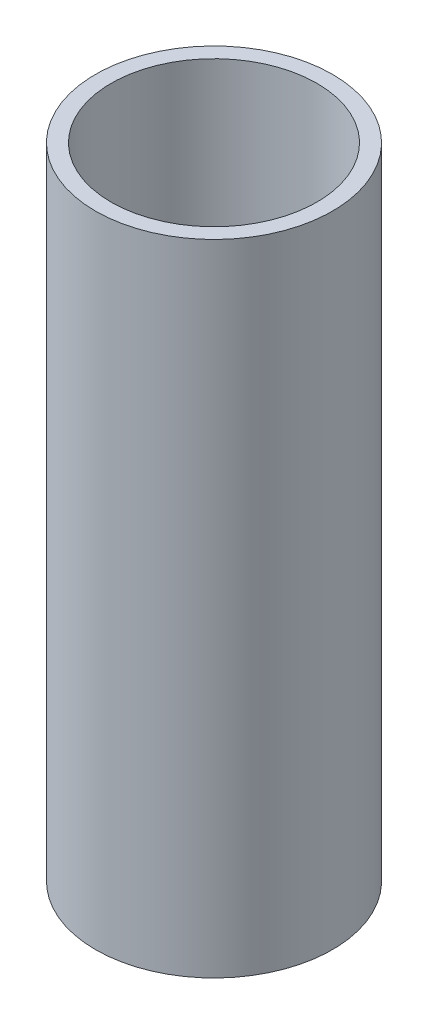
from build123d import *

# Parameters (mm, degrees)
SKETCH1_R           = 21.082
BOSS_EXTRUDE1_DEPTH = 113.792
SKETCH5_R           = 18.3134
CUT_EXTRUDE2_DEPTH  = 111.0234
SKETCH7_R           = 6.35
BOSS_EXTRUDE2_DEPTH = 10.16
THREAD1_PITCH       = 1.27
SKETCH19_R          = 4.445
CUT_EXTRUDE3_DEPTH  = 128.487253325


with BuildPart() as part:
    # Sketch1 → Boss-Extrude1 (new body)
    with BuildSketch(Plane(origin=(0, 0, 0), x_dir=(1, 0, 0), z_dir=(0, 1, 0))):
        with Locations(Location((0, 0, 0), (0, 0, 270))):
            Circle(SKETCH1_R)
    extrude(amount=BOSS_EXTRUDE1_DEPTH)

    # Sketch5 → Cut-Extrude2 (cut)
    with BuildSketch(Plane(origin=(0, 113.792, 0), x_dir=(1, 0, 0), z_dir=(0, 1, 0))):
        with Locations(Location((0, 0, 0), (0, 0, 270))):
            Circle(SKETCH5_R)
    extrude(amount=-CUT_EXTRUDE2_DEPTH, mode=Mode.SUBTRACT)

    # Sketch7 → Boss-Extrude2 (add)
    with BuildSketch(Plane.XZ):
        with Locations(Location((0, 0, 0), (0, 0, 270))):
            Circle(SKETCH7_R)
    extrude(amount=BOSS_EXTRUDE2_DEPTH)

    # Thread1: the profile of Thread Profile1 profile screwed along a right-hand helix of 8 turns, 8 arcs to a turn; built about Z, then put on its axis
    thread1_z = Axis((0, 0, 0), (0, 0, 1))
    thread1_corners = [(6.3503, 0, -0.000173205), (6.3503, 0, 1.111423202), (5.662592339, 0, 0.714374998), (5.662592339, 0, 0.396874998)]
    with BuildLine(mode=Mode.PRIVATE) as thread1_profile:
        Line(thread1_corners[0], thread1_corners[1])
        Line(thread1_corners[1], thread1_corners[2])
        Line(thread1_corners[2], thread1_corners[3])
        Line(thread1_corners[3], thread1_corners[0])
    thread1_cap = Face(thread1_profile.wire())
    thread1_turn_angles = [0, 22.5, 45, 67.5, 90, 112.5, 135, 157.5, 180, 202.5, 225, 247.5, 270, 292.5, 315, 337.5, 360]
    thread1_turn_weights = [1, 0.9238795325112867, 1, 0.9238795325112867, 1, 0.9238795325112867, 1, 0.9238795325112867, 1, 0.9238795325112867, 1, 0.9238795325112867, 1, 0.9238795325112867, 1, 0.9238795325112867, 1]
    thread1_turn_rails = [Edge.make_bspline([Vector(p[0], p[1], 0).rotate(thread1_z, thread1_turn_angles[k]) / thread1_turn_weights[k] + Vector(0, 0, p[2] + THREAD1_PITCH * thread1_turn_angles[k] / 360) for k in range(17)], [0, 0, 0, 1, 1, 2, 2, 3, 3, 4, 4, 5, 5, 6, 6, 7, 7, 8, 8, 8], 2, thread1_turn_weights) for p in thread1_corners]
    thread1_turn_sides = [Face.make_surface_from_curves(thread1_turn_rails[p[0]], thread1_turn_rails[p[1]]) for p in [(0, 1), (1, 2), (2, 3), (3, 0)]]
    thread1 = Plane(origin=(0, -10.16, 0), x_dir=(1, 0, 0), z_dir=(0, 1, 0)) * Solid(Shell([*[p.moved(Location((0, 0, THREAD1_PITCH * i))) for i in range(8) for p in thread1_turn_sides], thread1_cap, thread1_cap.rotate(thread1_z, 2880).moved(Location((0, 0, THREAD1_PITCH * 2880 / 360)))]))
    add(thread1, mode=Mode.SUBTRACT)

    # Sketch19 → Cut-Extrude3 (cut, through all)
    with BuildSketch(Plane.XZ.offset(10.16)):
        with Locations(Location((0, 0, 0), (0, 0, 270))):
            Circle(SKETCH19_R)
    extrude(amount=-CUT_EXTRUDE3_DEPTH, mode=Mode.SUBTRACT)


solid = part.part
